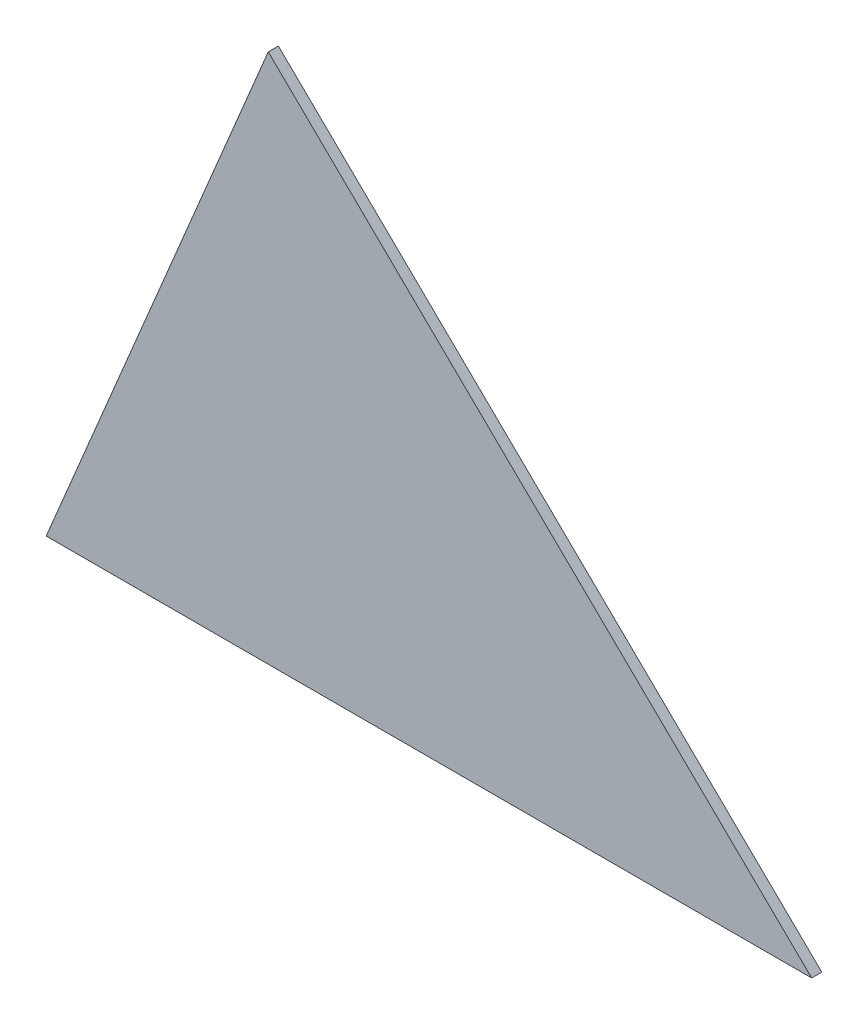
from build123d import *

# Parameters (mm, degrees)
BASE_FLANGE1_DEPTH = 1


# Sheet-metal steps are written as plain solids
with BuildPart() as part:
    # Sketch1 → Base-Flange1 (new body)
    with BuildSketch(Plane.XY):
        Polygon((-7.999367539, 30.320183414), (-29.933117242, -22.062771761), (45.673808206, -22.062771761), align=None)
    extrude(amount=-BASE_FLANGE1_DEPTH)


solid = part.part
